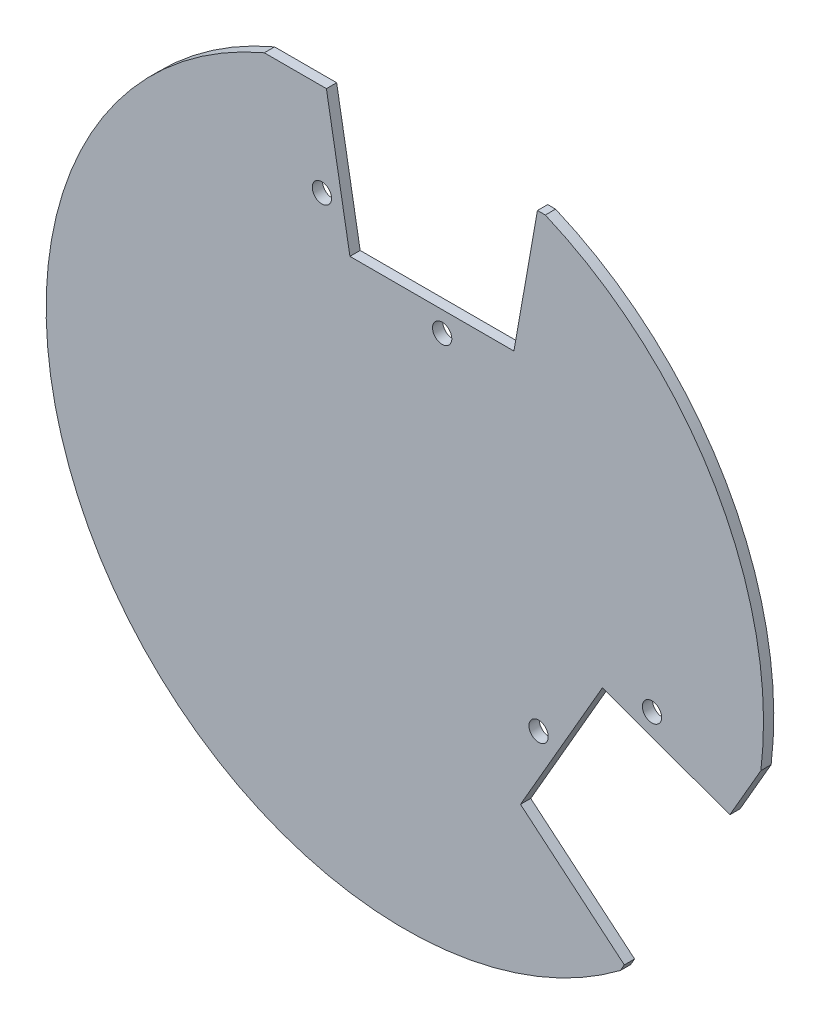
from build123d import *

# Parameters (mm, degrees)
ESQUISSE1_R             = 175
BOSS_EXTRU_1_DEPTH      = 5
ESQUISSE2_R             = 4.7
ENL_V_MAT_EXTRU_1_DEPTH = 5


with BuildPart() as part:
    # Esquisse1 → Boss.-Extru.1 (new body)
    with BuildSketch(Plane.XY):
        Circle(ESQUISSE1_R)
    extrude(amount=BOSS_EXTRU_1_DEPTH)

    # Esquisse2 → Enlèv. mat.-Extru.1 (cut)
    with BuildSketch(Plane(origin=(0, 0, 0), x_dir=(-1, 0, 0), z_dir=(0, 0, -1))):
        with Locations((-18.220426897, 85.887612711)):
            Circle(ESQUISSE2_R)
        with Locations((40.460378836, 115.887612711)):
            Circle(ESQUISSE2_R)
        with Locations((-65.270641029, -58.723158916)):
            Circle(ESQUISSE2_R)
        with Locations((-120.59180601, -22.904090436)):
            Circle(ESQUISSE2_R)
        Polygon((26.7795731, 95.88761271), (38.263317053, 161.015161015), (68.550112498, 161.015161015), (68.550112498, 190.246123658), (-94.990966298, 190.246123658), (-94.990966298, 161.015161015), (-64.704170853, 161.015161015), (-53.2204269, 95.88761271), align=None)
        Polygon((-96.430895065, -24.752015748), (-158.57487836, -47.370575906), (-173.718276082, -21.141441652), (-199.033032308, -35.756922974), (-117.262492911, -177.387651773), (-91.947736684, -162.772170451), (-107.091134406, -136.543036197), (-56.430895065, -94.034048051), align=None)
    extrude(amount=-ENL_V_MAT_EXTRU_1_DEPTH, mode=Mode.SUBTRACT)


solid = part.part
